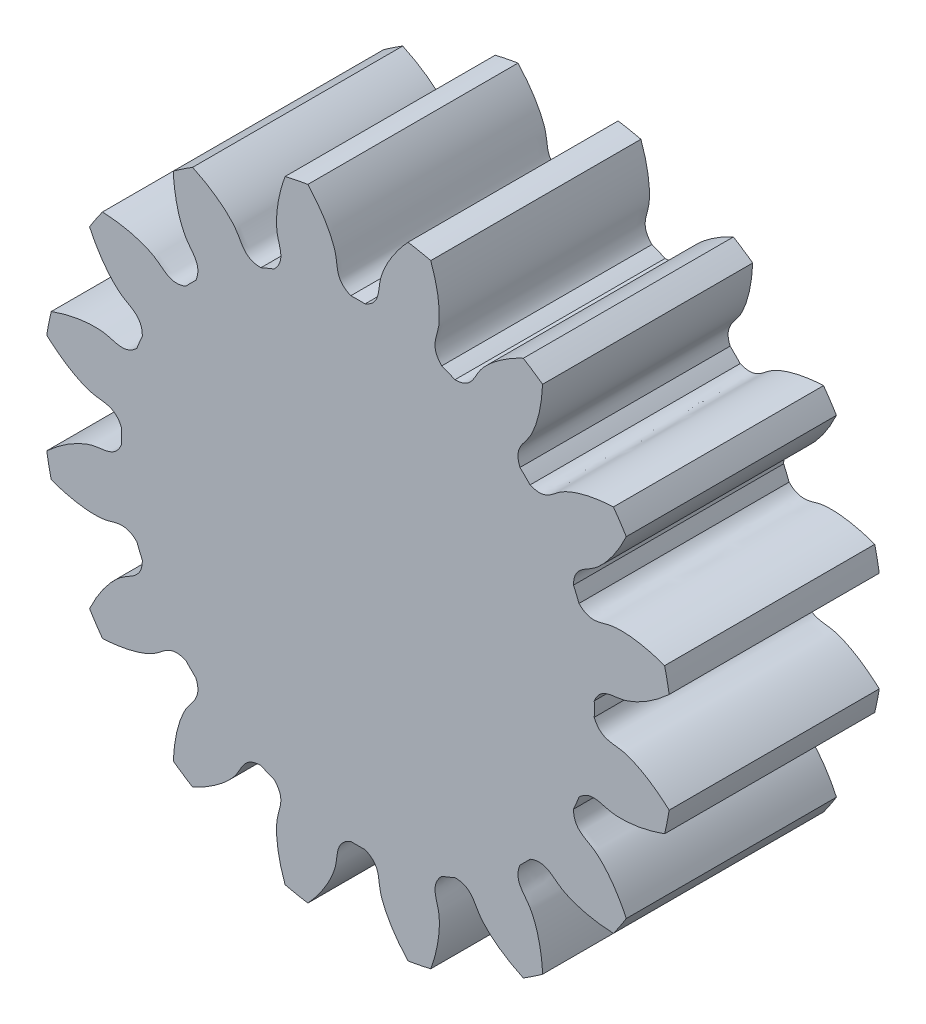
from build123d import *

# Parameters (mm, degrees)
SKETCH_1_R               = 4.5
EXTRUDE_1_DEPTH          = 3
CUT_EXTRUDE_1_DEPTH      = 8.03562364
PATTERN_CIRCULAR_1_COUNT = 16


with BuildPart() as part:
    # 草图1 → 凸台-拉伸1 (new body)
    with BuildSketch(Plane.XY):
        Circle(SKETCH_1_R)
    extrude(amount=EXTRUDE_1_DEPTH)

    # 草图2 → 切除-拉伸1 (cut, through all)
    with BuildSketch(Plane.XY):
        with BuildLine():
            ThreePointArc((0.101680395, 3.373467963), (0, 3.375), (-0.101680395, 3.373467963))
            add(Edge.make_bspline(
                [(-0.101680395, 3.373467963), (-0.320919735, 3.465061005), (-0.284660598, 3.635349809), (-0.322390644, 3.793404963), (-0.325601394, 3.80577545), (-0.329466049, 3.819526781), (-0.334039479, 3.834637453), (-0.339377888, 3.851083952), (-0.345536205, 3.868841182), (-0.352568839, 3.887882349), (-0.360529384, 3.908179024), (-0.369470654, 3.92970115), (-0.379444617, 3.952417062), (-0.390502356, 3.976293514), (-0.402694025, 4.001295699), (-0.416068812, 4.02738727), (-0.430674889, 4.054530373), (-0.446559381, 4.082685666), (-0.463768319, 4.111812348), (-0.482346604, 4.141868189), (-0.502337967, 4.172809557), (-0.523784931, 4.20459145), (-0.546728776, 4.237167525), (-0.571209498, 4.270490132), (-0.597265778, 4.304510345), (-0.624934946, 4.339177997), (-0.654252942, 4.374441713), (-0.685254293, 4.41024895), (-0.717972069, 4.446546028), (-0.752437861, 4.483278171), (-0.788681746, 4.520389541), (-0.826732258, 4.557823283), (-0.866616358, 4.595521557), (-0.90835941, 4.633425586), (-0.951985152, 4.67147569), (-0.99751567, 4.709611333), (-1.044971373, 4.747771162), (-1.094370973, 4.785893051), (-1.145731456, 4.823914147), (-1.199068069, 4.861770908), (-1.254394289, 4.899399156), (-1.311721817, 4.936734114), (-1.371060539, 4.97371046), (-1.453732402, 5.022959339), (-1.517494148, 5.058370721), (-1.560889991, 5.081371225)],
                knots=[0, 0, 0, 0, 0.200958108, 0.205848205, 0.211390316, 0.217584439, 0.224430575, 0.231928724, 0.240078886, 0.248881062, 0.25833525, 0.268441451, 0.279199665, 0.290609892, 0.302672132, 0.315386384, 0.32875265, 0.342770929, 0.357441221, 0.372763526, 0.388737843, 0.405364174, 0.422642518, 0.440572874, 0.459155244, 0.478389626, 0.498276022, 0.51881443, 0.540004852, 0.561847286, 0.584341734, 0.607488194, 0.631286667, 0.655737153, 0.680839653, 0.706594165, 0.73300069, 0.760059228, 0.787769779, 0.816132343, 0.84514692, 0.87481351, 0.905132113, 0.936102729, 1, 1, 1, 1], degree=3))
            ThreePointArc((-1.560889991, 5.081371225), (0, 5.315704195), (1.560889991, 5.081371225))
            add(Edge.make_bspline(
                [(0.101680395, 3.373467963), (0.320919735, 3.465061005), (0.284660598, 3.635349809), (0.322390644, 3.793404963), (0.325601394, 3.80577545), (0.329466049, 3.819526781), (0.334039479, 3.834637453), (0.339377888, 3.851083952), (0.345536205, 3.868841182), (0.352568839, 3.887882349), (0.360529384, 3.908179024), (0.369470654, 3.92970115), (0.379444617, 3.952417062), (0.390502356, 3.976293514), (0.402694025, 4.001295699), (0.416068812, 4.02738727), (0.430674889, 4.054530373), (0.446559381, 4.082685666), (0.463768319, 4.111812348), (0.482346604, 4.141868189), (0.502337967, 4.172809557), (0.523784931, 4.20459145), (0.546728776, 4.237167525), (0.571209498, 4.270490132), (0.597265778, 4.304510345), (0.624934946, 4.339177997), (0.654252942, 4.374441713), (0.685254293, 4.41024895), (0.717972069, 4.446546028), (0.752437861, 4.483278171), (0.788681746, 4.520389541), (0.826732258, 4.557823283), (0.866616358, 4.595521557), (0.90835941, 4.633425586), (0.951985152, 4.67147569), (0.99751567, 4.709611333), (1.044971373, 4.747771162), (1.094370973, 4.785893051), (1.145731456, 4.823914147), (1.199068069, 4.861770908), (1.254394289, 4.899399156), (1.311721817, 4.936734114), (1.371060539, 4.97371046), (1.453732402, 5.022959339), (1.517494148, 5.058370721), (1.560889991, 5.081371225)],
                knots=[0, 0, 0, 0, 0.200958108, 0.205848205, 0.211390316, 0.217584439, 0.224430575, 0.231928724, 0.240078886, 0.248881062, 0.25833525, 0.268441451, 0.279199665, 0.290609892, 0.302672132, 0.315386384, 0.32875265, 0.342770929, 0.357441221, 0.372763526, 0.388737843, 0.405364174, 0.422642518, 0.440572874, 0.459155244, 0.478389626, 0.498276022, 0.51881443, 0.540004852, 0.561847286, 0.584341734, 0.607488194, 0.631286667, 0.655737153, 0.680839653, 0.706594165, 0.73300069, 0.760059228, 0.787769779, 0.816132343, 0.84514692, 0.87481351, 0.905132113, 0.936102729, 1, 1, 1, 1], degree=3))
        make_face()
    cut_extrude_1 = extrude(amount=CUT_EXTRUDE_1_DEPTH, mode=Mode.SUBTRACT)

    # 阵列(圆周)1: 切除-拉伸1 ×16 about axis
    pattern_circular_1_axis = Axis((0, 0, 3), (0, 0, -1))
    for i in range(1, PATTERN_CIRCULAR_1_COUNT):
        add(cut_extrude_1.rotate(pattern_circular_1_axis, i * 360 / PATTERN_CIRCULAR_1_COUNT), mode=Mode.SUBTRACT)


solid = part.part
